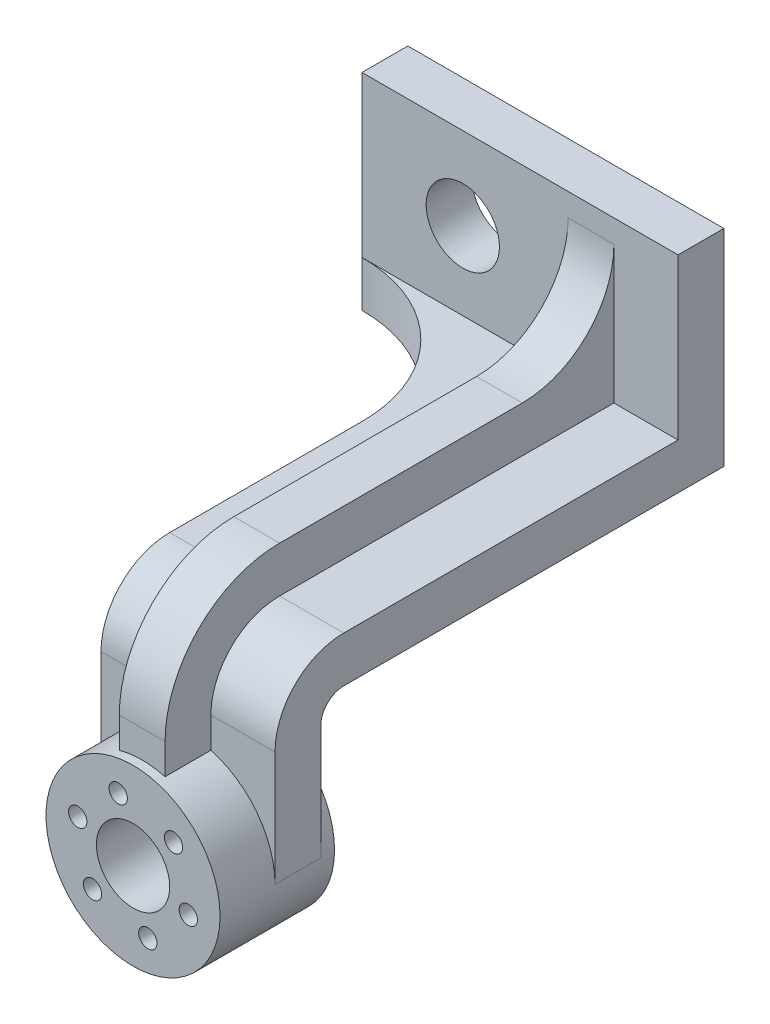
from build123d import *

# Parameters (mm, degrees)
SKETCH1_R                = 8
BOSS_EXTRUDE1_DEPTH      = 10
BOSS_EXTRUDE3_DEPTH      = 88
BOSS_EXTRUDE3_DEPTH_BACK = 10
SKETCH1_4_W              = 38
SKETCH1_4_H              = 10
BOSS_EXTRUDE4_START      = 88
BOSS_EXTRUDE4_DEPTH      = 10
BOSS_EXTRUDE5_START      = 100
SKETCH1_6_R              = 19
SKETCH1_6_R_2            = 2
SKETCH1_6_R_3            = 8
BOSS_EXTRUDE5_DEPTH      = 25
SKETCH1_7_W              = 31
SKETCH1_7_H              = 10
BOSS_EXTRUDE6_DEPTH      = 10
FILLET1_R                = 31
FILLET3_R                = 5
FILLET4_R                = 15
BOSS_EXTRUDE7_START      = -24
BOSS_EXTRUDE7_DEPTH      = 10
FILLET5_R                = 20


with BuildPart() as part:
    # Sketch1 → Boss-Extrude1 (new body)
    with BuildSketch(Plane.XY):
        Polygon((-38, 10), (0, 10), (0, 45), (-69, 45), (-69, 10), align=None)
        with Locations((-47, 27)):
            Circle(SKETCH1_R, mode=Mode.SUBTRACT)
    extrude(amount=-BOSS_EXTRUDE1_DEPTH)

    # Sketch1<4> → Boss-Extrude3 (add, two sides: drawn at the far end of the back side and taken through both)
    with BuildSketch(Plane.XY.offset(-BOSS_EXTRUDE3_DEPTH_BACK)):
        with Locations((-19, 5)):
            Rectangle(SKETCH1_4_W, SKETCH1_4_H)
    extrude(amount=BOSS_EXTRUDE3_DEPTH + BOSS_EXTRUDE3_DEPTH_BACK)

    # Sketch1<5> → Boss-Extrude4 (add)
    with BuildSketch(Plane.XY.offset(BOSS_EXTRUDE4_START)):
        with BuildLine():
            Line((0, -30), (0, 0))
            Line((0, 0), (-38, 0))
            Line((-38, 0), (-38, -30))
            ThreePointArc((-38, -30), (-19, -11), (0, -30))
        make_face()
    extrude(amount=-BOSS_EXTRUDE4_DEPTH)

    # Sketch1<6> → Boss-Extrude5 (add)
    with BuildSketch(Plane.XY.offset(BOSS_EXTRUDE5_START)):
        with Locations((-19, -30)):
            Circle(SKETCH1_6_R)
        with Locations((-22.235238064, -17.925927171)):
            Circle(SKETCH1_6_R_2, mode=Mode.SUBTRACT)
        with Locations((-31.074072829, -26.764761936)):
            Circle(SKETCH1_6_R_2, mode=Mode.SUBTRACT)
        with Locations((-27.838834765, -38.838834765)):
            Circle(SKETCH1_6_R_2, mode=Mode.SUBTRACT)
        with Locations((-15.764761936, -42.074072829)):
            Circle(SKETCH1_6_R_2, mode=Mode.SUBTRACT)
        with Locations((-6.925927171, -33.235238064)):
            Circle(SKETCH1_6_R_2, mode=Mode.SUBTRACT)
        with Locations((-10.161165235, -21.161165235)):
            Circle(SKETCH1_6_R_2, mode=Mode.SUBTRACT)
        with Locations((-19, -30)):
            Circle(SKETCH1_6_R_3, mode=Mode.SUBTRACT)
    extrude(amount=-BOSS_EXTRUDE5_DEPTH)

    # Sketch1<7> → Boss-Extrude6 (add)
    with BuildSketch(Plane.XY):
        with Locations((-53.5, 5)):
            Rectangle(SKETCH1_7_W, SKETCH1_7_H)
    extrude(amount=-BOSS_EXTRUDE6_DEPTH)

    # Fillet1
    fillet1_edges = [part.edges().sort_by_distance(p)[0] for p in [
        (-38, 5, 0),
    ]]
    fillet(fillet1_edges, radius=FILLET1_R - 0.0001)  # a hair under: the kernel refuses the full size

    # Fillet3
    fillet3_edges = [part.edges().sort_by_distance(p)[0] for p in [
        (-19, 0, 78),
    ]]
    fillet(fillet3_edges, radius=FILLET3_R)

    # Fillet4
    fillet4_edges = [part.edges().sort_by_distance(p)[0] for p in [
        (-19, 10, 88),
    ]]
    fillet(fillet4_edges, radius=FILLET4_R)

    # Sketch2 → Boss-Extrude7 (add)
    with BuildSketch(Plane(origin=(0, 0, 0), x_dir=(0, 0, -1), z_dir=(1, 0, 0)).offset(BOSS_EXTRUDE7_START)):
        with BuildLine():
            Line((-98, -13), (-88, -13))
            Line((-88, -13), (-88, -5))
            ThreePointArc((-88, -5), (-83.606601718, 5.606601718), (-73, 10))
            Line((-73, 10), (0, 10))
            Line((0, 10), (0, 20))
            Line((0, 20), (-73, 20))
            ThreePointArc((-73, 20), (-90.67766953, 12.67766953), (-98, -5))
            Line((-98, -5), (-98, -13))
        make_face()
    extrude(amount=BOSS_EXTRUDE7_DEPTH)

    # Fillet5
    fillet5_edges = [part.edges().sort_by_distance(p)[0] for p in [
        (-19, 20, 0),
    ]]
    fillet(fillet5_edges, radius=FILLET5_R)


solid = part.part
